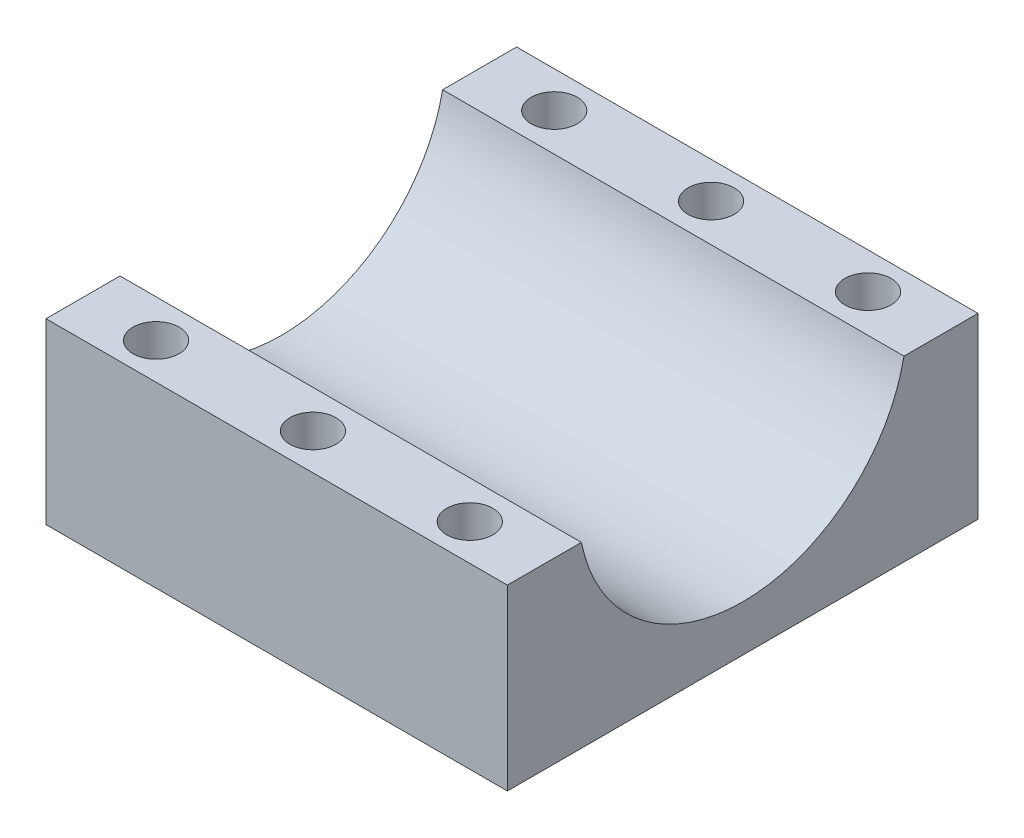
from build123d import *

# Parameters (mm, degrees)
SKETCH1_W           = 50
SKETCH1_H           = 51
SKETCH1_R           = 2.5
BOSS_EXTRUDE1_DEPTH = 19.325
SKETCH2_R           = 17.825
CUT_EXTRUDE1_DEPTH  = 60.36080883


with BuildPart() as part:
    # Sketch1 → Boss-Extrude1 (new body)
    with BuildSketch(Plane(origin=(0, 0, 0), x_dir=(1, 0, 0), z_dir=(0, 1, 0))):
        Rectangle(SKETCH1_W, SKETCH1_H)
        with Locations((-17, 21.575)):
            Circle(SKETCH1_R, mode=Mode.SUBTRACT)
        with Locations((17, 21.575)):
            Circle(SKETCH1_R, mode=Mode.SUBTRACT)
        with Locations((17, -21.575)):
            Circle(SKETCH1_R, mode=Mode.SUBTRACT)
        with Locations((-17, -21.575)):
            Circle(SKETCH1_R, mode=Mode.SUBTRACT)
        with Locations((0, 21.575)):
            Circle(SKETCH1_R, mode=Mode.SUBTRACT)
        with Locations((0, -21.575)):
            Circle(SKETCH1_R, mode=Mode.SUBTRACT)
    extrude(amount=BOSS_EXTRUDE1_DEPTH)

    # Sketch2 → Cut-Extrude1 (cut, through all)
    with BuildSketch(Plane(origin=(25, 0, 0), x_dir=(0, 0, -1), z_dir=(1, 0, 0))):
        with Locations((0, 22.825)):
            Circle(SKETCH2_R)
    extrude(amount=-CUT_EXTRUDE1_DEPTH, mode=Mode.SUBTRACT)


solid = part.part
